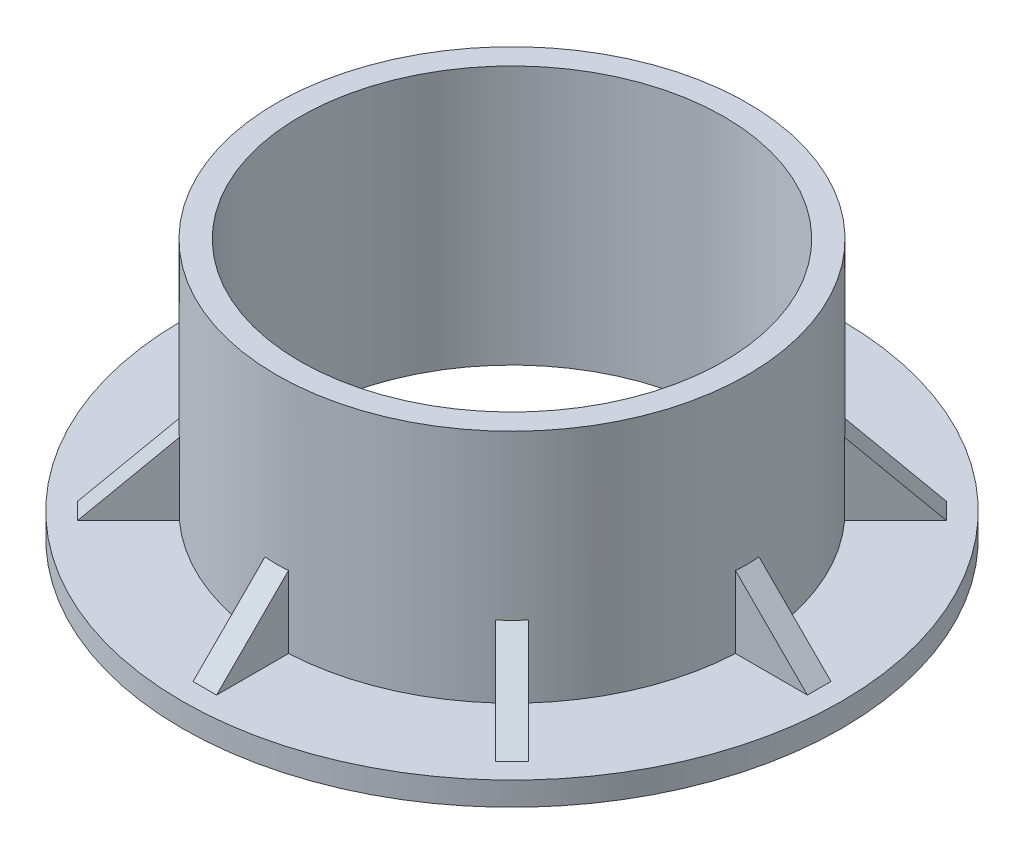
from build123d import *

# Parameters (mm, degrees)
SKETCH1_R           = 50
SKETCH1_R_2         = 45
BOSS_EXTRUDE1_DEPTH = 50
BOSS_EXTRUDE2_START = 5
SKETCH2_R           = 70
SKETCH2_R_2         = 45
BOSS_EXTRUDE2_DEPTH = 5
RIB1_REACH          = 112.905
SKETCH3_WALL_W      = 239.437922236
SKETCH3_WALL_H      = 5
CIRPATTERN1_COUNT   = 8


with BuildPart() as part:
    # Sketch1 → Boss-Extrude1 (new body)
    with BuildSketch(Plane(origin=(0, 0, 0), x_dir=(1, 0, 0), z_dir=(0, 1, 0))):
        Circle(SKETCH1_R)
        Circle(SKETCH1_R_2, mode=Mode.SUBTRACT)
    extrude(amount=BOSS_EXTRUDE1_DEPTH)

    # Sketch2 → Boss-Extrude2 (add)
    with BuildSketch(Plane.XZ.offset(BOSS_EXTRUDE2_START)):
        Circle(SKETCH2_R)
        Circle(SKETCH2_R_2, mode=Mode.SUBTRACT)
    extrude(amount=-BOSS_EXTRUDE2_DEPTH)

    # Sketch3 wall → Rib1 (add, up to next)
    with BuildSketch(Plane(origin=(0, 7.519718592, 57.699715082), x_dir=(0, -0.707106781187, 0.707106781187), z_dir=(0, -0.707106781187, -0.707106781187)), mode=Mode.PRIVATE) as rib1_sk1:
        Rectangle(SKETCH3_WALL_W, SKETCH3_WALL_H)
    rib1_tool1 = extrude(rib1_sk1.sketch, amount=RIB1_REACH, mode=Mode.PRIVATE) - part.part
    rib1 = rib1_tool1.solids().sort_by_distance((0, 7.519718592, 57.699715082))[0]
    add(rib1)

    # CirPattern1: Rib1 ×8 about axis
    cirpattern1_axis = Axis((0, -8.144073756, 0), (0, 1, 0))
    for i in range(1, CIRPATTERN1_COUNT):
        add(rib1.rotate(cirpattern1_axis, i * 360 / CIRPATTERN1_COUNT))


solid = part.part
